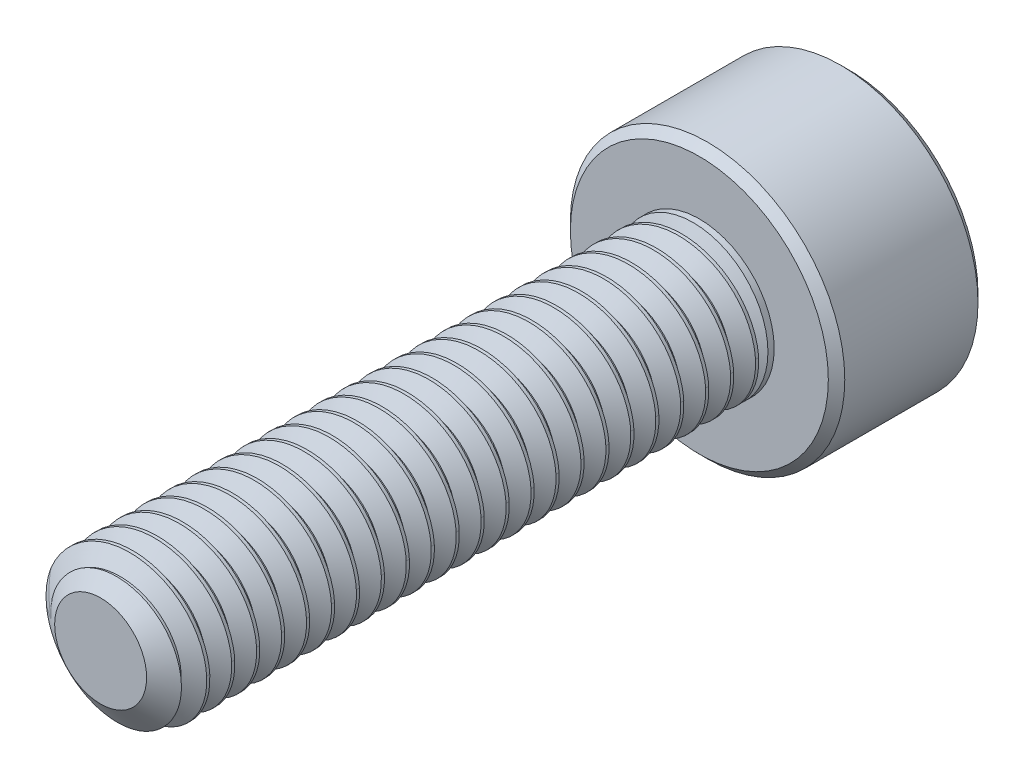
from build123d import *

# Parameters (mm, degrees)
SKETCH1_R          = 1.5
EXTRUDE1_DEPTH     = 12
CUT_SWEEP1_PITCH   = 0.5
SKETCH6_R          = 2.75
EXTRUDE2_DEPTH     = 3
CUT_EXTRUDE1_DEPTH = 1.875
CHAMFER1_SIZE      = 0.165


with BuildPart() as part:
    # Sketch1 → Extrude1 (new body)
    with BuildSketch(Plane.XY):
        Circle(SKETCH1_R)
    extrude(amount=-EXTRUDE1_DEPTH)

    # Cut-Sweep1: the profile of Sketch3 profile screwed along a right-hand helix of 25 turns, 6 arcs to a turn; built about Z, then put on its axis
    cut_sweep1_z = Axis((0, 0, 0), (0, 0, 1))
    cut_sweep1_corners = [(1.5003, 0, -0.437673205), (1.175240474, 0, -0.25), (1.175240474, 0, -0.1875), (1.5003, 0, 0.000173205)]
    with BuildLine(mode=Mode.PRIVATE) as cut_sweep1_profile:
        Line(cut_sweep1_corners[0], cut_sweep1_corners[1])
        Line(cut_sweep1_corners[1], cut_sweep1_corners[2])
        Line(cut_sweep1_corners[2], cut_sweep1_corners[3])
        Line(cut_sweep1_corners[3], cut_sweep1_corners[0])
    cut_sweep1_cap = Face(cut_sweep1_profile.wire())
    cut_sweep1_turn_angles = [0, 30, 60, 90, 120, 150, 180, 210, 240, 270, 300, 330, 360]
    cut_sweep1_turn_weights = [1, 0.8660254037844387, 1, 0.8660254037844387, 1, 0.8660254037844387, 1, 0.8660254037844387, 1, 0.8660254037844387, 1, 0.8660254037844387, 1]
    cut_sweep1_turn_rails = [Edge.make_bspline([Vector(p[0], p[1], 0).rotate(cut_sweep1_z, cut_sweep1_turn_angles[k]) / cut_sweep1_turn_weights[k] + Vector(0, 0, p[2] + CUT_SWEEP1_PITCH * cut_sweep1_turn_angles[k] / 360) for k in range(13)], [0, 0, 0, 1, 1, 2, 2, 3, 3, 4, 4, 5, 5, 6, 6, 6], 2, cut_sweep1_turn_weights) for p in cut_sweep1_corners]
    cut_sweep1_turn_sides = [Face.make_surface_from_curves(cut_sweep1_turn_rails[p[0]], cut_sweep1_turn_rails[p[1]]) for p in [(0, 1), (1, 2), (2, 3), (3, 0)]]
    cut_sweep1 = Plane(origin=(0, 0, 0), x_dir=(0, 1, 0), z_dir=(0, 0, -1)) * Solid(Shell([*[p.moved(Location((0, 0, CUT_SWEEP1_PITCH * i))) for i in range(25) for p in cut_sweep1_turn_sides], cut_sweep1_cap, cut_sweep1_cap.rotate(cut_sweep1_z, 9000).moved(Location((0, 0, CUT_SWEEP1_PITCH * 9000 / 360)))]))
    add(cut_sweep1, mode=Mode.SUBTRACT)

    # Sketch4 → Cut-Revolve1 (revolve, cut)
    with BuildSketch(Plane(origin=(0, 0, 0), x_dir=(0, 0, -1), z_dir=(1, 0, 0)), mode=Mode.PRIVATE) as cut_revolve1_sk:
        Polygon((0.405251783, 1.5), (0, 0.921240474), (0, 1.5), align=None)
    revolve(cut_revolve1_sk.sketch.rotate(Axis((0, 0, 0), (0, 0, -1)), 263.352109169), axis=Axis((0, 0, 0), (0, 0, -1)), mode=Mode.SUBTRACT)

    # Sketch6 → Extrude2 (add)
    with BuildSketch(Plane(origin=(0, 0, -12), x_dir=(-1, 0, 0), z_dir=(0, 0, -1))):
        Circle(SKETCH6_R)
    extrude(amount=EXTRUDE2_DEPTH)

    # Sketch7 → Cut-Extrude1 (cut)
    with BuildSketch(Plane(origin=(0, 0, -15), x_dir=(-1, 0, 0), z_dir=(0, 0, -1))):
        Polygon((0, 1.443375673), (-1.25, 0.721687836), (-1.25, -0.721687836), (0, -1.443375673), (1.25, -0.721687836), (1.25, 0.721687836), align=None)
    extrude(amount=-CUT_EXTRUDE1_DEPTH, mode=Mode.SUBTRACT)

    # Cut-Extrude2 cone 1 section (through the dimple's axis) → Cut-Extrude2 (revolve, cut)
    with BuildSketch(Plane(origin=(0, 0, -15), x_dir=(0, 1, 0), z_dir=(1, 0, 0))):
        Polygon((0, 0), (1.443375673, 0), (0, 1.443375673), align=None)
    revolve(axis=Axis((0, 0, -15), (0, 0, 1)), mode=Mode.SUBTRACT)

    # Chamfer1
    chamfer1_edges = [part.edges().sort_by_distance(p)[0] for p in [
        (2.75, 0, -12),
        (2.75, 0, -15),
    ]]
    chamfer(chamfer1_edges, length=CHAMFER1_SIZE)

    # Sketch10 → Revolve1 (revolve)
    with BuildSketch(Plane(origin=(0, 0, 0), x_dir=(0, 0, -1), z_dir=(1, 0, 0)), mode=Mode.PRIVATE) as revolve1_sk:
        Polygon((12, 1.5), (12, 0), (11.253679656, 0), (11.875, 1.5), align=None)
    revolve(revolve1_sk.sketch.rotate(Axis((0, 0, -12), (0, 0, 1)), 270), axis=Axis((0, 0, -12), (0, 0, 1)))


solid = part.part
